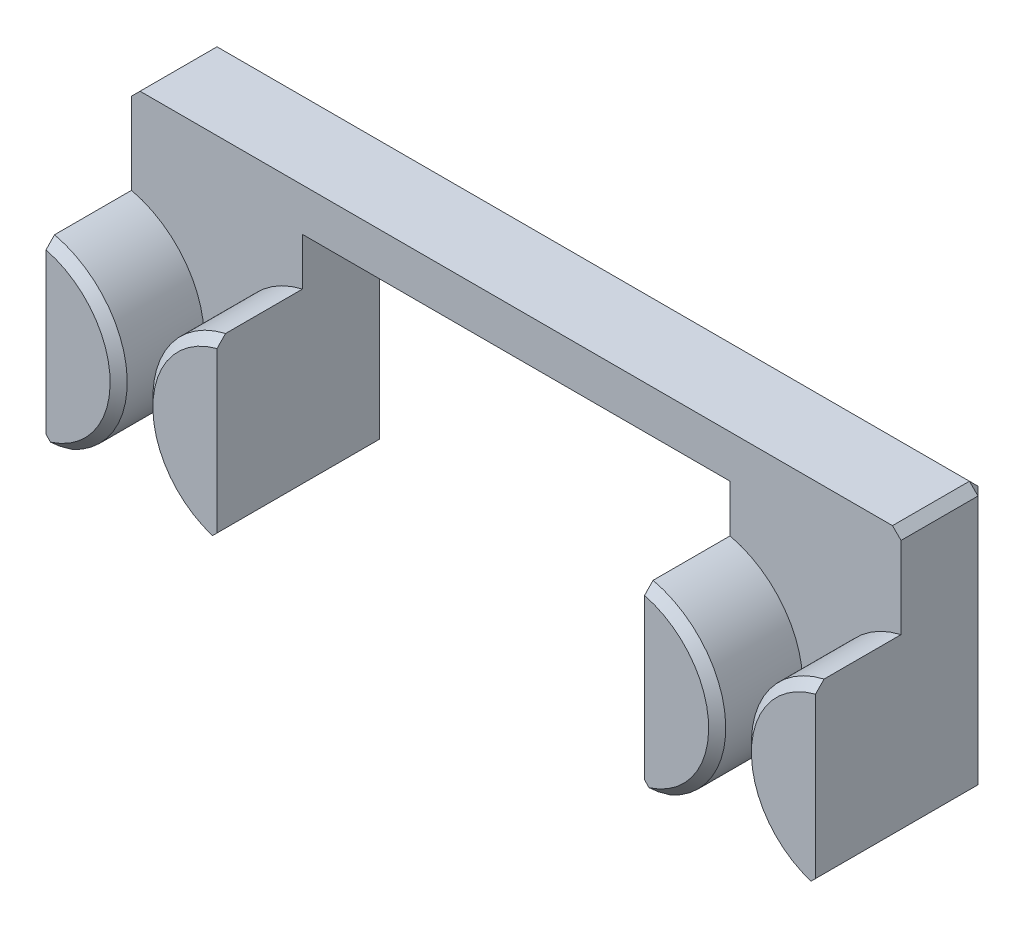
from build123d import *

# Parameters (mm, degrees)
BOSS_EXTRUDE1_DEPTH  = 2
BOSS_EXTRUDE2_DEPTH  = 2
MIRROR2_COPY_1_DEPTH = 2


with BuildPart() as part:
    # Sketch1 → Boss-Extrude1 (new body)
    with BuildSketch(Plane.XY):
        Polygon((-9, 3.125), (9, 3.125), (9, -3.125), (5, -3.125), (5, 2.125), (-5, 2.125), (-5, -3.125), (-9, -3.125), align=None)
    extrude(amount=-BOSS_EXTRUDE1_DEPTH)

    # Sketch2 → Boss-Extrude2 (add)
    with BuildSketch(Plane.XY):
        with BuildLine():
            Line((9, -3.125), (9, 1.017428529))
            ThreePointArc((9, 1.017428529), (7.311037389, -0.904903006), (8.583484861, -3.125))
            Line((8.583484861, -3.125), (9, -3.125))
        make_face()
    boss_extrude2 = extrude(amount=BOSS_EXTRUDE2_DEPTH)

    # Mirror1: Boss-Extrude2 across plane
    add(boss_extrude2.mirror(Plane(origin=(7, 0, 0), x_dir=(0, 0, 1), z_dir=(1, 0, 0))))

    # Mirror2: Boss-Extrude2 across plane
    add(boss_extrude2.mirror(Plane(origin=(0, 0, 0), x_dir=(0, 0, 1), z_dir=(1, 0, 0))))

    # Mirror2 copy 1 sketch → Mirror2 copy 1 (add)
    with BuildSketch(Plane(origin=(-14, 0, 0), x_dir=(1, 0, 0), z_dir=(0, 0, 1))):
        with BuildLine():
            Line((9, -3.125), (9, 1.017428529))
            ThreePointArc((9, 1.017428529), (7.311037389, -0.904903006), (8.583484861, -3.125))
            Line((8.583484861, -3.125), (9, -3.125))
        make_face()
    extrude(amount=MIRROR2_COPY_1_DEPTH)

    # Deburs
    # the kernel refuses this chamfer: 0.2 mm, written as the material it takes off along each edge
    with BuildSketch(Plane(origin=(-8.866666667, 2.991666667, -1.866666667), x_dir=(0, -0.7071067811865479, -0.7071067811865471), z_dir=(-0.5773502691896264, 0.5773502691896251, -0.5773502691896257)), Plane(origin=(5.133333333, -2.991666667, -1.866666667), x_dir=(0, -0.7071067811865479, 0.7071067811865471), z_dir=(-0.5773502691896256, -0.5773502691896256, -0.5773502691896262)), Plane(origin=(-8.866666667, -2.991666667, -1.866666667), x_dir=(0, -0.7071067811865479, 0.7071067811865471), z_dir=(-0.5773502691896272, -0.5773502691896246, -0.5773502691896253))) as deburs_piece_1:
        Polygon((-0.141421356, -0.081649658), (0.141421356, -0.081649658), (0, 0.163299316), align=None)
    extrude(amount=0.254034118, mode=Mode.SUBTRACT)
    with BuildSketch(Plane(origin=(8.866666667, 2.991666667, -1.866666667), x_dir=(0, -0.7071067811865479, -0.7071067811865471), z_dir=(0.5773502691896272, 0.5773502691896246, -0.5773502691896253)), Plane(origin=(8.866666667, -2.991666667, -1.866666667), x_dir=(-0.7071067811865465, 0, -0.7071067811865488), z_dir=(0.5773502691896272, -0.5773502691896246, -0.5773502691896253)), Plane(origin=(-5.133333333, -2.991666667, -1.866666667), x_dir=(3.140184917367542e-15, -0.7071067811865464, 0.7071067811865487), z_dir=(0.5773502691896256, -0.5773502691896255, -0.5773502691896262))) as deburs_piece_2:
        Polygon((-0.141421356, 0.081649658), (0.141421356, 0.081649658), (0, -0.163299316), align=None)
    extrude(amount=0.254034118, mode=Mode.SUBTRACT)
    with BuildSketch(Plane(origin=(-9.514336598, 3.125, -2), x_dir=(0, 0.02749587661058736, 0.9996219169112966), z_dir=(1, 0, 0))) as deburs_piece_3:
        with BuildLine():
            Line((0.205734639, 0), (-0.011309431, 0.205423559))
            Line((-0.011309431, 0.205423559), (-0.015307919, 0.205313575))
            ThreePointArc((-0.015307919, 0.205313575), (-0.006825845, 0.102679566), (-0.003998488, -0.000109984))
            Line((-0.003998488, -0.000109984), (0.000109984, -0.003998488))
            ThreePointArc((0.000109984, -0.003998488), (0.102899533, -0.00117113), (0.205844623, -0.003998488))
            Line((0.205844623, -0.003998488), (0.205734639, 0))
        make_face()
    extrude(amount=19.028673195, mode=Mode.SUBTRACT)
    with BuildSketch(Plane(origin=(9, 3.125, 0.514336598), x_dir=(-0.9996219169112966, 0.02749587661058742, 0), z_dir=(0, 0, -1))) as deburs_piece_4:
        with BuildLine():
            Line((0.205734639, 0), (-0.011309431, -0.205423559))
            Line((-0.011309431, -0.205423559), (-0.015307919, -0.205313575))
            ThreePointArc((-0.015307919, -0.205313575), (-0.006825845, -0.102679566), (-0.003998488, 0.000109984))
            Line((-0.003998488, 0.000109984), (0.000109984, 0.003998488))
            ThreePointArc((0.000109984, 0.003998488), (0.102899533, 0.00117113), (0.205844623, 0.003998488))
            Line((0.205844623, 0.003998488), (0.205734639, 0))
        make_face()
    extrude(amount=3.028673195, mode=Mode.SUBTRACT)
    with BuildSketch(Plane(origin=(9, 3.639336598, -2), x_dir=(-0.9996219169112966, 0, -0.02749587661058742), z_dir=(0, -1, 0)), Plane(origin=(-9, -3.639336598, -2), x_dir=(0.9996219169112966, 0, -0.02749587661058742), z_dir=(0, 1, 0))) as deburs_piece_5:
        with BuildLine():
            Line((0.205734639, 0), (-0.011309431, -0.205423559))
            Line((-0.011309431, -0.205423559), (-0.015307919, -0.205313575))
            ThreePointArc((-0.015307919, -0.205313575), (-0.006825845, -0.102679566), (-0.003998488, 0.000109984))
            Line((-0.003998488, 0.000109984), (0.000109984, 0.003998488))
            ThreePointArc((0.000109984, 0.003998488), (0.102899533, 0.00117113), (0.205844623, 0.003998488))
            Line((0.205844623, 0.003998488), (0.205734639, 0))
        make_face()
    extrude(amount=7.278673195, mode=Mode.SUBTRACT)
    with BuildSketch(Plane(origin=(9, -3.125, 2.514336598), x_dir=(-0.9996219169112966, -0.02749587661058742, 0), z_dir=(0, 0, -1)), Plane(origin=(5, -3.125, 2.514336598), x_dir=(-0.027495876610587302, 0.9996219169112966, 0), z_dir=(0, 0, -1)), Plane(origin=(-9, -3.125, -2.514336598), x_dir=(0.9996219169112966, -0.02749587661058742, -1.3226059551012301e-15), z_dir=(0, 0, 1))) as deburs_piece_6:
        with BuildLine():
            Line((0.205734639, 0), (-0.011309431, 0.205423559))
            Line((-0.011309431, 0.205423559), (-0.015307919, 0.205313575))
            ThreePointArc((-0.015307919, 0.205313575), (-0.006825845, 0.102679566), (-0.003998488, -0.000109984))
            Line((-0.003998488, -0.000109984), (0.000109984, -0.003998488))
            ThreePointArc((0.000109984, -0.003998488), (0.102899533, -0.00117113), (0.205844623, -0.003998488))
            Line((0.205844623, -0.003998488), (0.205734639, 0))
        make_face()
    extrude(amount=5.028673195, mode=Mode.SUBTRACT)
    with BuildSketch(Plane(origin=(9.514336598, -3.125, -2), x_dir=(0, 0.9996219169112966, -0.027495876610587302), z_dir=(-1, 0, 0)), Plane(origin=(-5, -3.125, -2.514336598), x_dir=(-0.9996219169112966, -0.027495876610587302, 4.0013970761285496e-15), z_dir=(0, 0, 1)), Plane(origin=(-4.485663402, -3.125, -2), x_dir=(0, 0.9996219169112966, -0.027495876610587302), z_dir=(-1, 0, 0))) as deburs_piece_7:
        with BuildLine():
            Line((0.205734639, 0), (-0.011309431, -0.205423559))
            Line((-0.011309431, -0.205423559), (-0.015307919, -0.205313575))
            ThreePointArc((-0.015307919, -0.205313575), (-0.006825845, -0.102679566), (-0.003998488, 0.000109984))
            Line((-0.003998488, 0.000109984), (0.000109984, 0.003998488))
            ThreePointArc((0.000109984, 0.003998488), (0.102899533, 0.00117113), (0.205844623, 0.003998488))
            Line((0.205844623, 0.003998488), (0.205734639, 0))
        make_face()
    extrude(amount=5.028673195, mode=Mode.SUBTRACT)
    with BuildSketch(Plane(origin=(5, -3.639336598, -2), x_dir=(0.9996219169112966, 0, -0.027495876610587302), z_dir=(0, 1, 0)), Plane(origin=(-5, 2.125, -2), x_dir=(-0.9996219169112966, 0, -0.027495876610587302), z_dir=(0, -1, 0))) as deburs_piece_8:
        with BuildLine():
            Line((0.205734639, 0), (-0.011309431, -0.205423559))
            Line((-0.011309431, -0.205423559), (-0.015307919, -0.205313575))
            ThreePointArc((-0.015307919, -0.205313575), (-0.006825845, -0.102679566), (-0.003998488, 0.000109984))
            Line((-0.003998488, 0.000109984), (0.000109984, 0.003998488))
            ThreePointArc((0.000109984, 0.003998488), (0.102899533, 0.00117113), (0.205844623, 0.003998488))
            Line((0.205844623, 0.003998488), (0.205734639, 0))
        make_face()
    extrude(amount=5.764336598, mode=Mode.SUBTRACT)
    with BuildSketch(Plane(origin=(5, 2.125, -2), x_dir=(0, 0.9996219169112966, -0.027495876610587302), z_dir=(-1, 0, 0))) as deburs_piece_9:
        with BuildLine():
            Line((0.205734639, 0), (-0.011309431, -0.205423559))
            Line((-0.011309431, -0.205423559), (-0.015307919, -0.205313575))
            ThreePointArc((-0.015307919, -0.205313575), (-0.006825845, -0.102679566), (-0.003998488, 0.000109984))
            Line((-0.003998488, 0.000109984), (0.000109984, 0.003998488))
            ThreePointArc((0.000109984, 0.003998488), (0.102899533, 0.00117113), (0.205844623, 0.003998488))
            Line((0.205844623, 0.003998488), (0.205734639, 0))
        make_face()
    extrude(amount=10, mode=Mode.SUBTRACT)
    with BuildSketch(Plane(origin=(-9, 3.125, 0.514336598), x_dir=(0.9996219169112966, 0.02749587661058742, 0), z_dir=(0, 0, -1))) as deburs_piece_10:
        with BuildLine():
            Line((0.205734639, 0), (-0.011309431, 0.205423559))
            Line((-0.011309431, 0.205423559), (-0.015307919, 0.205313575))
            ThreePointArc((-0.015307919, 0.205313575), (-0.006825845, 0.102679566), (-0.003998488, -0.000109984))
            Line((-0.003998488, -0.000109984), (0.000109984, -0.003998488))
            ThreePointArc((0.000109984, -0.003998488), (0.102899533, -0.00117113), (0.205844623, -0.003998488))
            Line((0.205844623, -0.003998488), (0.205734639, 0))
        make_face()
    extrude(amount=3.028673195, mode=Mode.SUBTRACT)
    with BuildSketch(Plane(origin=(9.5, -1.125, 2), x_dir=(0.004747833317757314, 0.9999887289758754, 0), z_dir=(0.9999887289758754, -0.004747833317757314, 0))) as deburs_piece_11:
        with BuildLine():
            Line((1.994343146, 0.005656854), (2.205656854, -0.205656854))
            Line((2.205656854, -0.205656854), (2.209656854, -0.205656854))
            ThreePointArc((2.209656854, -0.205656854), (2.204, -0.102828427), (2.204, 0))
            Line((2.204, 0), (2.2, 0.004))
            ThreePointArc((2.2, 0.004), (2.097171573, 0.004), (1.994343146, 0.009656854))
            Line((1.994343146, 0.009656854), (1.994343146, 0.005656854))
        make_face()
    revolve(axis=Axis((9.5, -1.125, 2), (0, 0, 1)), revolution_arc=169.060645124, mode=Mode.SUBTRACT)
    with BuildSketch(Plane(origin=(4.5, -1.125, 2), x_dir=(-0.004747833317757314, 0.9999887289758754, 0), z_dir=(-0.9999887289758754, -0.004747833317757314, 0))) as deburs_piece_12:
        with BuildLine():
            Line((1.994343146, -0.005656854), (2.205656854, 0.205656854))
            Line((2.205656854, 0.205656854), (2.209656854, 0.205656854))
            ThreePointArc((2.209656854, 0.205656854), (2.204, 0.102828427), (2.204, 0))
            Line((2.204, 0), (2.2, -0.004))
            ThreePointArc((2.2, -0.004), (2.097171573, -0.004), (1.994343146, -0.009656854))
            Line((1.994343146, -0.009656854), (1.994343146, -0.005656854))
        make_face()
    revolve(axis=Axis((4.5, -1.125, 2), (0, 0, -1)), revolution_arc=169.060645124, mode=Mode.SUBTRACT)
    with BuildSketch(Plane(origin=(-4.5, -1.125, 2), x_dir=(0.004747833317757314, 0.9999887289758754, 0), z_dir=(0.9999887289758754, -0.004747833317757314, 0))) as deburs_piece_13:
        with BuildLine():
            Line((1.994343146, 0.005656854), (2.205656854, -0.205656854))
            Line((2.205656854, -0.205656854), (2.209656854, -0.205656854))
            ThreePointArc((2.209656854, -0.205656854), (2.204, -0.102828427), (2.204, 0))
            Line((2.204, 0), (2.2, 0.004))
            ThreePointArc((2.2, 0.004), (2.097171573, 0.004), (1.994343146, 0.009656854))
            Line((1.994343146, 0.009656854), (1.994343146, 0.005656854))
        make_face()
    revolve(axis=Axis((-4.5, -1.125, 2), (0, 0, 1)), revolution_arc=169.060645124, mode=Mode.SUBTRACT)
    with BuildSketch(Plane(origin=(-9.5, -1.125, 2), x_dir=(-0.004747833317757314, 0.9999887289758754, 0), z_dir=(-0.9999887289758754, -0.004747833317757314, 0))) as deburs_piece_14:
        with BuildLine():
            Line((2.205656854, 0.205656854), (1.994343146, -0.005656854))
            Line((1.994343146, -0.005656854), (1.994343146, -0.009656854))
            ThreePointArc((1.994343146, -0.009656854), (2.097171573, -0.004), (2.2, -0.004))
            Line((2.2, -0.004), (2.204, 0))
            ThreePointArc((2.204, 0), (2.204, 0.102828427), (2.209656854, 0.205656854))
            Line((2.209656854, 0.205656854), (2.205656854, 0.205656854))
        make_face()
    revolve(axis=Axis((-9.5, -1.125, 2), (0, 0, -1)), revolution_arc=169.060645124, mode=Mode.SUBTRACT)
    with BuildSketch(Plane(origin=(5, -3.639336598, -2), x_dir=(0.9996219169112966, 0, -0.027495876610587302), z_dir=(0, 1, 0))) as deburs_piece_15a_section:
        with BuildLine():
            Line((0.205734639, 0), (-0.011309431, -0.205423559))
            Line((-0.011309431, -0.205423559), (-0.015307919, -0.205313575))
            ThreePointArc((-0.015307919, -0.205313575), (-0.006825845, -0.102679566), (-0.003998488, 0.000109984))
            Line((-0.003998488, 0.000109984), (0.000109984, 0.003998488))
            ThreePointArc((0.000109984, 0.003998488), (0.102899533, 0.00117113), (0.205844623, 0.003998488))
            Line((0.205844623, 0.003998488), (0.205734639, 0))
        make_face()
    deburs_piece_15a = extrude(amount=6.278673195, mode=Mode.PRIVATE)
    deburs_piece_15a = split(deburs_piece_15a, bisect_by=Plane(origin=(5.065958725, 2.125, -1.934041275), z_dir=(0, 1, 0)), keep=Keep.TOP, mode=Mode.PRIVATE)
    with BuildSketch(Plane(origin=(5.514336598, 2.125, -2), x_dir=(0, 0.9996219169112966, -0.027495876610587302), z_dir=(-1, 0, 0))) as deburs_piece_15b_section:
        with BuildLine():
            Line((0.205734639, 0), (-0.011309431, -0.205423559))
            Line((-0.011309431, -0.205423559), (-0.015307919, -0.205313575))
            ThreePointArc((-0.015307919, -0.205313575), (-0.006825845, -0.102679566), (-0.003998488, 0.000109984))
            Line((-0.003998488, 0.000109984), (0.000109984, 0.003998488))
            ThreePointArc((0.000109984, 0.003998488), (0.102899533, 0.00117113), (0.205844623, 0.003998488))
            Line((0.205844623, 0.003998488), (0.205734639, 0))
        make_face()
    deburs_piece_15b = extrude(amount=10.514336598, mode=Mode.PRIVATE)
    deburs_piece_15b = split(deburs_piece_15b, bisect_by=Plane(origin=(5, 2.190958725, -1.934041275), z_dir=(1, 0, 0)), keep=Keep.TOP, mode=Mode.PRIVATE)
    deburs_piece_15 = deburs_piece_15a & deburs_piece_15b
    add(deburs_piece_15, mode=Mode.SUBTRACT)
    with BuildSketch(Plane(origin=(5, 2.125, -2), x_dir=(0, 0.9996219169112966, -0.027495876610587302), z_dir=(-1, 0, 0))) as deburs_piece_16a_section:
        with BuildLine():
            Line((0.205734639, 0), (-0.011309431, -0.205423559))
            Line((-0.011309431, -0.205423559), (-0.015307919, -0.205313575))
            ThreePointArc((-0.015307919, -0.205313575), (-0.006825845, -0.102679566), (-0.003998488, 0.000109984))
            Line((-0.003998488, 0.000109984), (0.000109984, 0.003998488))
            ThreePointArc((0.000109984, 0.003998488), (0.102899533, 0.00117113), (0.205844623, 0.003998488))
            Line((0.205844623, 0.003998488), (0.205734639, 0))
        make_face()
    deburs_piece_16a = extrude(amount=10.514336598, mode=Mode.PRIVATE)
    deburs_piece_16a = split(deburs_piece_16a, bisect_by=Plane(origin=(-5, 2.190958725, -1.934041275), z_dir=(-1, 0, 0)), keep=Keep.TOP, mode=Mode.PRIVATE)
    with BuildSketch(Plane(origin=(-5, 2.639336598, -2), x_dir=(-0.9996219169112966, 0, -0.027495876610587302), z_dir=(0, -1, 0))) as deburs_piece_16b_section:
        with BuildLine():
            Line((0.205734639, 0), (-0.011309431, -0.205423559))
            Line((-0.011309431, -0.205423559), (-0.015307919, -0.205313575))
            ThreePointArc((-0.015307919, -0.205313575), (-0.006825845, -0.102679566), (-0.003998488, 0.000109984))
            Line((-0.003998488, 0.000109984), (0.000109984, 0.003998488))
            ThreePointArc((0.000109984, 0.003998488), (0.102899533, 0.00117113), (0.205844623, 0.003998488))
            Line((0.205844623, 0.003998488), (0.205734639, 0))
        make_face()
    deburs_piece_16b = extrude(amount=6.278673195, mode=Mode.PRIVATE)
    deburs_piece_16b = split(deburs_piece_16b, bisect_by=Plane(origin=(-5.065958725, 2.125, -1.934041275), z_dir=(0, 1, 0)), keep=Keep.TOP, mode=Mode.PRIVATE)
    deburs_piece_16 = deburs_piece_16a & deburs_piece_16b
    add(deburs_piece_16, mode=Mode.SUBTRACT)


solid = part.part
